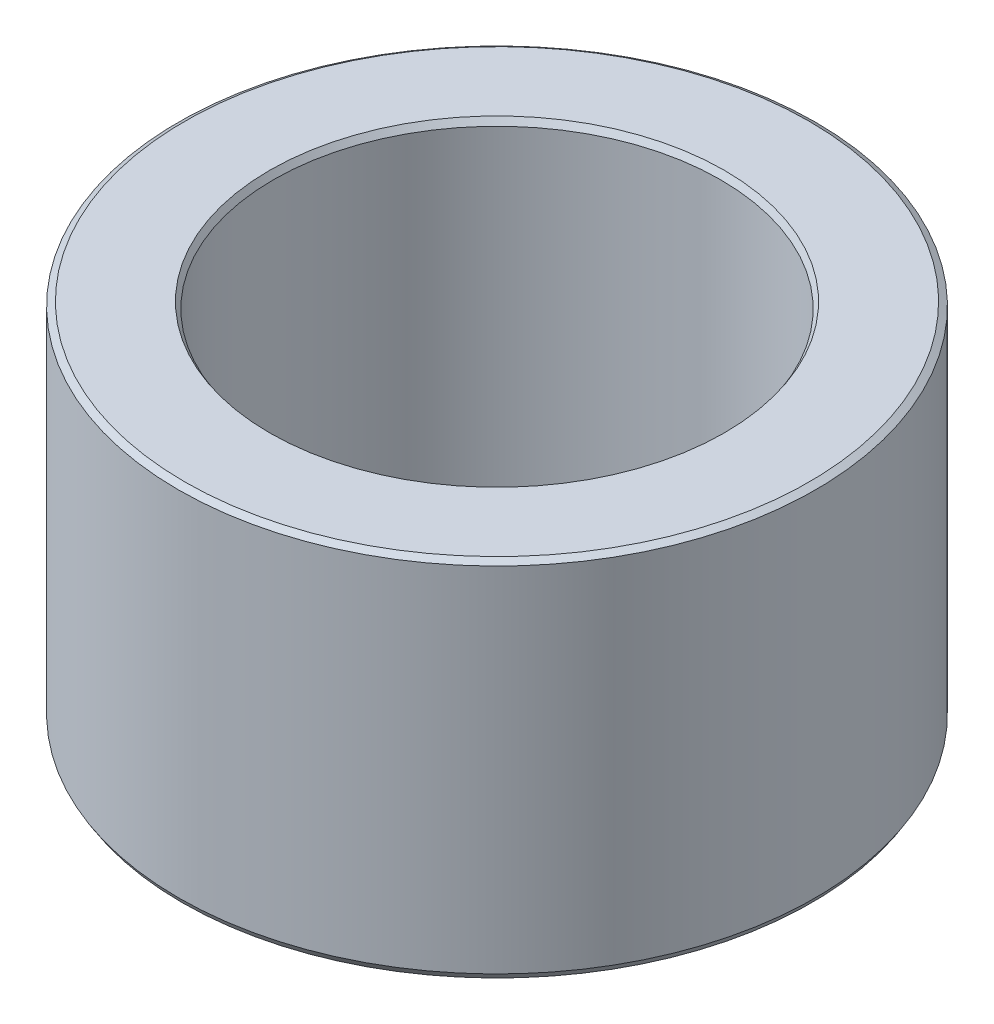
from build123d import *
from OCP.BRepFilletAPI import BRepFilletAPI_MakeChamfer

# Parameters (mm, degrees)
SKETCH1_R           = 52.5
BOSS_EXTRUDE1_DEPTH = 59.884762315
SKETCH2_R           = 36.852388474
CUT_EXTRUDE1_DEPTH  = 96.387026149
CHAMFER1_SIZE       = 0.630821891
CHAMFER1_SIZE2      = 1.025383903


with BuildPart() as part:
    # Sketch1 → Boss-Extrude1 (new body)
    with BuildSketch(Plane(origin=(0, 0, 0), x_dir=(1, 0, 0), z_dir=(0, 1, 0))):
        Circle(SKETCH1_R)
    extrude(amount=BOSS_EXTRUDE1_DEPTH)

    # Sketch2 → Cut-Extrude1 (cut, through all)
    with BuildSketch(Plane(origin=(0, 0, 0), x_dir=(1, 0, 0), z_dir=(0, 1, 0))):
        Circle(SKETCH2_R)
    extrude(amount=CUT_EXTRUDE1_DEPTH, mode=Mode.SUBTRACT)

    # Chamfer1: one chamfer whose edges measure the first distance from different faces: ONE call of the kernel's chamfer builder (chamfer() names one face for all edges)
    chamfer1_edges_1 = [part.edges().sort_by_distance(p)[0] for p in [
        (-36.852388474, 59.884762315, 0),
    ]]
    chamfer1_side_1 = [part.faces().sort_by_distance(p)[0] for p in [
        (-51.01507576, 59.884762315, 0),
    ]]
    chamfer1_edges_2 = [part.edges().sort_by_distance(p)[0] for p in [
        (-36.852388474, 0, 0),
    ]]
    chamfer1_side_2 = [part.faces().sort_by_distance(p)[0] for p in [
        (-36.852388474, 29.942381158, 0),
    ]]
    chamfer1_edges_3 = [part.edges().sort_by_distance(p)[0] for p in [
        (-52.5, 0, 0),
    ]]
    chamfer1_side_3 = [part.faces().sort_by_distance(p)[0] for p in [
        (-51.01507576, 0, 0),
    ]]
    chamfer1_edges_4 = [part.edges().sort_by_distance(p)[0] for p in [
        (-52.5, 59.884762315, 0),
    ]]
    chamfer1_side_4 = [part.faces().sort_by_distance(p)[0] for p in [
        (-52.5, 29.942381158, 0),
    ]]
    chamfer1 = BRepFilletAPI_MakeChamfer(part.part.solid().wrapped)
    for e in chamfer1_edges_1:
        chamfer1.Add(CHAMFER1_SIZE, CHAMFER1_SIZE2, e.wrapped, chamfer1_side_1[0].wrapped)  # the first distance lies on this face
    for e in chamfer1_edges_2:
        chamfer1.Add(CHAMFER1_SIZE, CHAMFER1_SIZE2, e.wrapped, chamfer1_side_2[0].wrapped)  # the first distance lies on this face
    for e in chamfer1_edges_3:
        chamfer1.Add(CHAMFER1_SIZE, CHAMFER1_SIZE2, e.wrapped, chamfer1_side_3[0].wrapped)  # the first distance lies on this face
    for e in chamfer1_edges_4:
        chamfer1.Add(CHAMFER1_SIZE, CHAMFER1_SIZE2, e.wrapped, chamfer1_side_4[0].wrapped)  # the first distance lies on this face
    add(Compound.cast(chamfer1.Shape()), mode=Mode.REPLACE)


solid = part.part
